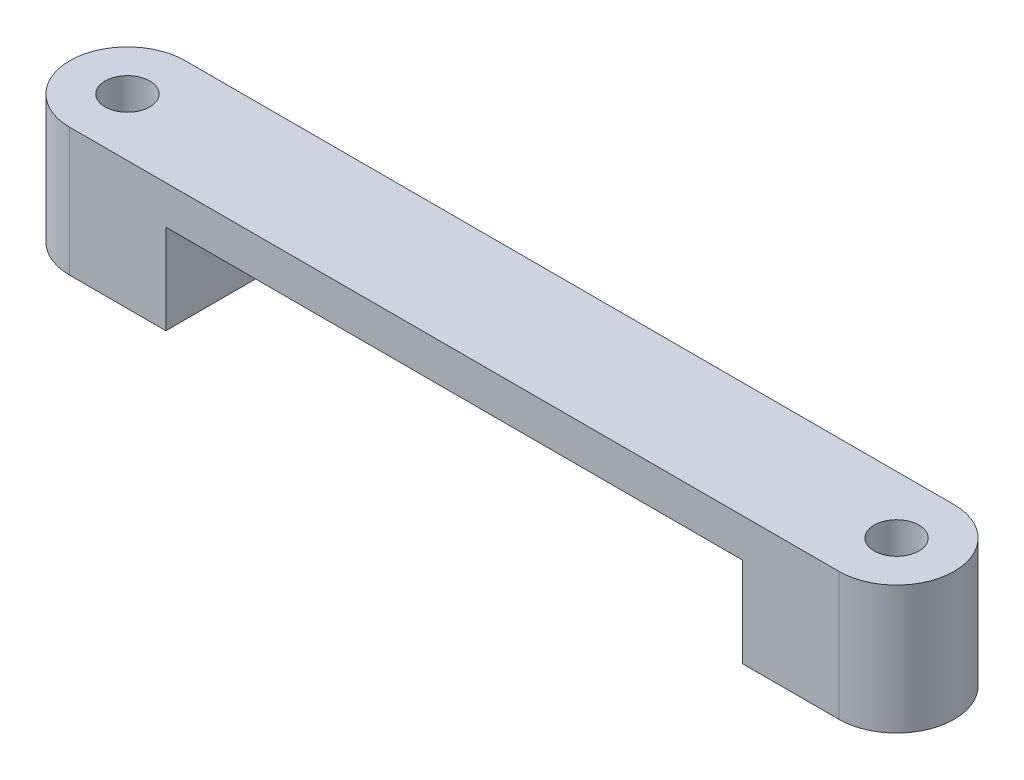
from build123d import *

# Parameters (mm, degrees)
SKETCH1_R               = 1.75
BOSS_EXTRUDE1_DEPTH     = 5
CUT_EXTRUDE1_DEPTH      = 36.149679942
CUT_EXTRUDE1_DEPTH_BACK = 36.149679942
SKETCH2_W               = 45
SKETCH2_H               = 7


with BuildPart() as part:
    # Sketch1 → Boss-Extrude1 (new, symmetric)
    with BuildSketch(Plane(origin=(0, 0, 0), x_dir=(1, 0, 0), z_dir=(0, 1, 0))):
        with BuildLine():
            Line((30, -4.5), (-30, -4.5))
            ThreePointArc((-30, -4.5), (-34.5, 0), (-30, 4.5))
            Line((-30, 4.5), (30, 4.5))
            ThreePointArc((30, 4.5), (34.5, 0), (30, -4.5))
        make_face()
        with Locations((-30, 0)):
            Circle(SKETCH1_R, mode=Mode.SUBTRACT)
        with Locations((30, 0)):
            Circle(SKETCH1_R, mode=Mode.SUBTRACT)
    extrude(amount=BOSS_EXTRUDE1_DEPTH, both=True)

    # Sketch2 → Cut-Extrude1 (cut, two sides: drawn at the far end of the back side and taken through both)
    with BuildSketch(Plane.XY.offset(-CUT_EXTRUDE1_DEPTH_BACK)):
        with Locations((0, -1.5)):
            Rectangle(SKETCH2_W, SKETCH2_H)
    extrude(amount=CUT_EXTRUDE1_DEPTH + CUT_EXTRUDE1_DEPTH_BACK, mode=Mode.SUBTRACT)


solid = part.part
